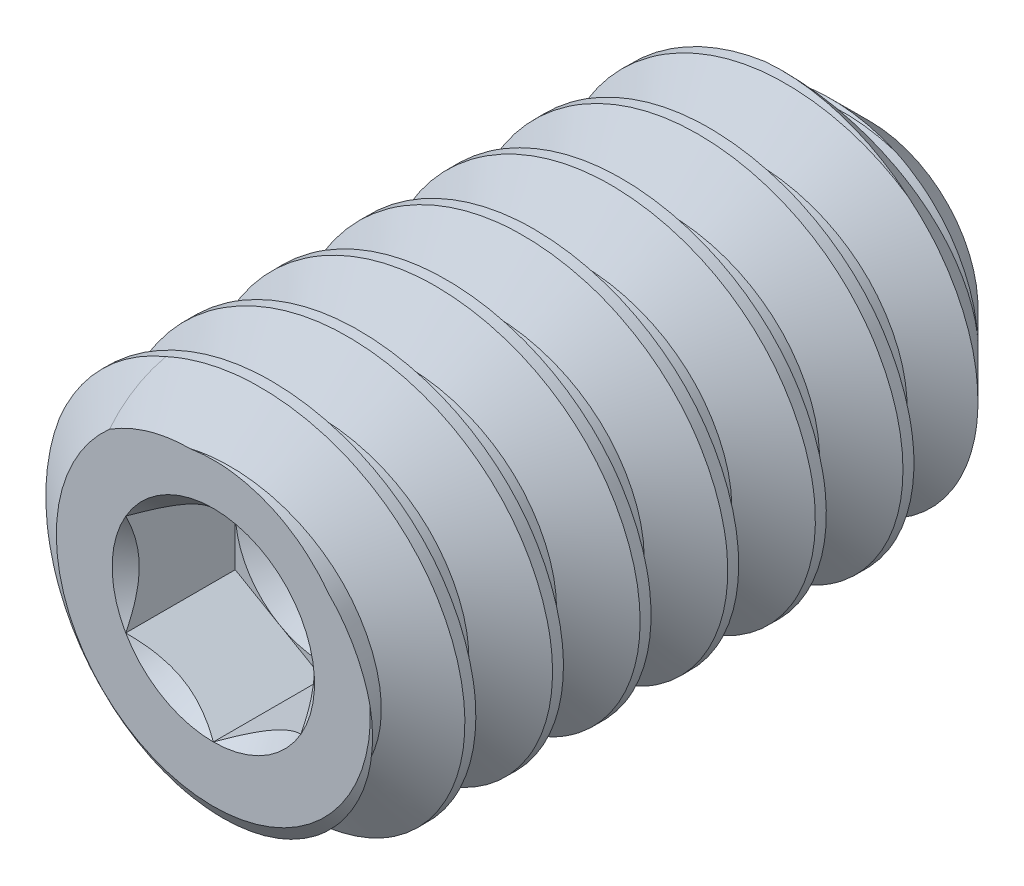
from build123d import *

# Parameters (mm, degrees)
CUT_SWEEP2_PITCH    = 0.635
CUT_EXTRUDE10_DEPTH = 0.79375


with BuildPart() as part:
    # Sketch22 → Revolve1 (revolve)
    with BuildSketch(Plane(origin=(0, 0, 0), x_dir=(0, 0, -1), z_dir=(1, 0, 0)), mode=Mode.PRIVATE) as revolve1_sk:
        Polygon((-2.147087021, 0), (-2.147087021, 1.13792), (-1.947891981, 1.4224), (1.972438262, 1.4224), (2.615412979, 0.779425283), (2.147087021, 0), align=None)
    revolve(revolve1_sk.sketch.rotate(Axis((0, 0, -2.147087021), (0, 0, -1)), 180), axis=Axis((0, 0, -2.147087021), (0, 0, -1)))

    # Cut-Sweep2: the profile of Sketch28 profile screwed along a right-hand helix of 8.9 turns, 6 arcs to a turn; built about Z, then put on its axis
    cut_sweep2_z = Axis((0, 0, 0), (0, 0, 1))
    cut_sweep2_corners = [(1.4227, 0, 0.000173205), (1.4227, 0, -0.555798205), (1.037451708, 0, -0.333375), (1.037451708, 0, -0.22225)]
    with BuildLine(mode=Mode.PRIVATE) as cut_sweep2_profile:
        Line(cut_sweep2_corners[0], cut_sweep2_corners[1])
        Line(cut_sweep2_corners[1], cut_sweep2_corners[2])
        Line(cut_sweep2_corners[2], cut_sweep2_corners[3])
        Line(cut_sweep2_corners[3], cut_sweep2_corners[0])
    cut_sweep2_cap = Face(cut_sweep2_profile.wire())
    cut_sweep2_turn_angles = [0, 30, 60, 90, 120, 150, 180, 210, 240, 270, 300, 330, 360]
    cut_sweep2_turn_weights = [1, 0.8660254037844387, 1, 0.8660254037844387, 1, 0.8660254037844387, 1, 0.8660254037844387, 1, 0.8660254037844387, 1, 0.8660254037844387, 1]
    cut_sweep2_turn_rails = [Edge.make_bspline([Vector(p[0], p[1], 0).rotate(cut_sweep2_z, cut_sweep2_turn_angles[k]) / cut_sweep2_turn_weights[k] + Vector(0, 0, p[2] + CUT_SWEEP2_PITCH * cut_sweep2_turn_angles[k] / 360) for k in range(13)], [0, 0, 0, 1, 1, 2, 2, 3, 3, 4, 4, 5, 5, 6, 6, 6], 2, cut_sweep2_turn_weights) for p in cut_sweep2_corners]
    cut_sweep2_turn_sides = [Face.make_surface_from_curves(cut_sweep2_turn_rails[p[0]], cut_sweep2_turn_rails[p[1]]) for p in [(0, 1), (1, 2), (2, 3), (3, 0)]]
    cut_sweep2_last_angles = [2880, 2910, 2940, 2970, 3000, 3030, 3060, 3090, 3120, 3150, 3180, 3192, 3204]
    cut_sweep2_last_weights = [1, 0.8660254037844387, 1, 0.8660254037844387, 1, 0.8660254037844387, 1, 0.8660254037844387, 1, 0.8660254037844387, 1, 0.9781476007338262, 1]
    cut_sweep2_last_rails = [Edge.make_bspline([Vector(p[0], p[1], 0).rotate(cut_sweep2_z, cut_sweep2_last_angles[k]) / cut_sweep2_last_weights[k] + Vector(0, 0, p[2] + CUT_SWEEP2_PITCH * cut_sweep2_last_angles[k] / 360) for k in range(13)], [0, 0, 0, 1, 1, 2, 2, 3, 3, 4, 4, 5, 5, 6, 6, 6], 2, cut_sweep2_last_weights) for p in cut_sweep2_corners]
    cut_sweep2_last_sides = [Face.make_surface_from_curves(cut_sweep2_last_rails[p[0]], cut_sweep2_last_rails[p[1]]) for p in [(0, 1), (1, 2), (2, 3), (3, 0)]]
    cut_sweep2 = Plane(origin=(0, 0, -2.615412979), x_dir=(0, 1, 0), z_dir=(0, 0, 1)) * Solid(Shell([*[p.moved(Location((0, 0, CUT_SWEEP2_PITCH * i))) for i in range(8) for p in cut_sweep2_turn_sides], *cut_sweep2_last_sides, cut_sweep2_cap, cut_sweep2_cap.rotate(cut_sweep2_z, 3204).moved(Location((0, 0, CUT_SWEEP2_PITCH * 3204 / 360)))]))
    add(cut_sweep2, mode=Mode.SUBTRACT)

    # Sketch23 → Cut-Extrude10 (cut)
    with BuildSketch(Plane.XY.offset(2.147087021)):
        Polygon((0, 0.733234842), (-0.635, 0.366617421), (-0.635, -0.366617421), (0, -0.733234842), (0.635, -0.366617421), (0.635, 0.366617421), align=None)
    extrude(amount=-CUT_EXTRUDE10_DEPTH, mode=Mode.SUBTRACT)

    # Cut-Extrude11 cone 1 section (through the dimple's axis) → Cut-Extrude11 (revolve, cut)
    with BuildSketch(Plane(origin=(0, 0, 2.147087021), x_dir=(0, -1, 0), z_dir=(1, 0, 0))):
        Polygon((0, 0), (0.733234842, 0), (0, 0.733234842), align=None)
    revolve(axis=Axis((0, 0, 2.147087021), (0, 0, -1)), mode=Mode.SUBTRACT)

    # Cut-Extrude12 cone 1 section (through the dimple's axis) → Cut-Extrude12 (revolve, cut)
    with BuildSketch(Plane(origin=(0, 0, 1.353337021), x_dir=(0, -1, 0), z_dir=(1, 0, 0))):
        Polygon((0, 0), (0.635, 0), (0, 0.366617421), align=None)
    revolve(axis=Axis((0, 0, 1.353337021), (0, 0, -1)), mode=Mode.SUBTRACT)


solid = part.part
